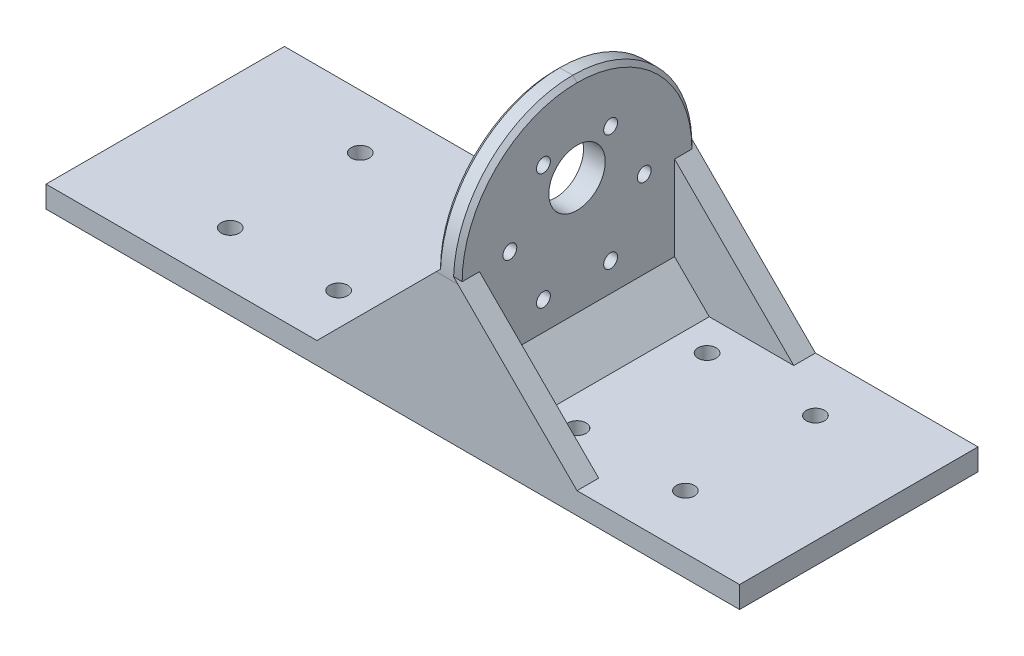
from build123d import *

# Parameters (mm, degrees)
SKETCH_1_W          = 160
SKETCH_1_H          = 55
EXTRUDE_1_DEPTH     = 5
EXTRUDE_2_DEPTH     = 55
FILLET_1_R          = 27.5
CUT_EXTRUDE_1_REACH = 113.608
SKETCH_3_R          = 6.5
SKETCH_4_R          = 1.6
CUT_EXTRUDE_2_DEPTH = 10
CHAMFER_1_SIZE      = 8
CHAMFER_2_SIZE      = 8
EXTRUDE_5_DEPTH     = 5
CHAMFER_3_SIZE      = 1
SKETCH_7_R          = 2.1
CUT_EXTRUDE_3_DEPTH = 5


# Some blends are built 0.0001 mm under size
with BuildPart() as part:
    # 草图1 → 凸台-拉伸1 (new body)
    with BuildSketch(Plane(origin=(0, 0, 0), x_dir=(1, 0, 0), z_dir=(0, 1, 0))):
        Rectangle(SKETCH_1_W, SKETCH_1_H)
    extrude(amount=EXTRUDE_1_DEPTH)

    # 草图2 → 凸台-拉伸2 (add)
    with BuildSketch(Plane(origin=(0, 5, 0), x_dir=(1, 0, 0), z_dir=(0, 1, 0))):
        Polygon((10, 0), (10, 27.5), (15, 27.5), (15, -27.5), (10, -27.5), align=None)
    extrude(amount=EXTRUDE_2_DEPTH)

    # 圆角1
    fillet_1_edges = [part.edges().sort_by_distance(p)[0] for p in [
        (12.5, 60, -27.5),
        (12.5, 60, 27.5),
    ]]
    fillet(fillet_1_edges, radius=FILLET_1_R - 0.0001)  # a hair under: the kernel refuses the full size

    # 草图3 → 切除-拉伸1 (cut, up to next)
    with BuildSketch(Plane.ZY.offset(-10), mode=Mode.PRIVATE) as cut_extrude_1_sk1:
        with Locations((0, 40)):
            Circle(SKETCH_3_R)
    cut_extrude_1_tool1 = extrude(cut_extrude_1_sk1.sketch, amount=-CUT_EXTRUDE_1_REACH, mode=Mode.PRIVATE) & part.part
    add(cut_extrude_1_tool1.solids().sort_by_distance((10, 40, 0))[0], mode=Mode.SUBTRACT)

    # 草图4 → 切除-拉伸2 (cut)
    with BuildSketch(Plane.ZY.offset(-10)):
        with Locations((15.5, 33)):
            Circle(SKETCH_4_R)
        with Locations((7.75, 19.576606241)):
            Circle(SKETCH_4_R)
        with Locations((-7.75, 19.576606241)):
            Circle(SKETCH_4_R)
        with Locations((-15.5, 33)):
            Circle(SKETCH_4_R)
        with Locations((-7.75, 46.423393759)):
            Circle(SKETCH_4_R)
        with Locations((7.75, 46.423393759)):
            Circle(SKETCH_4_R)
    extrude(amount=-CUT_EXTRUDE_2_DEPTH, mode=Mode.SUBTRACT)

    # 倒角1
    chamfer_1_edges = [part.edges().sort_by_distance(p)[0] for p in [
        (10, 5, 0),
    ]]
    chamfer(chamfer_1_edges, length=CHAMFER_1_SIZE)

    # 倒角2
    chamfer_2_edges = [part.edges().sort_by_distance(p)[0] for p in [
        (15, 5, 0),
    ]]
    chamfer(chamfer_2_edges, length=CHAMFER_2_SIZE)

    # 草图6 → 凸台-拉伸5 (add)
    with BuildSketch(Plane.XY.offset(27.5)):
        Polygon((10, 5), (10, 32.5), (-17.5, 5), align=None)
        Polygon((15, 32.5), (15, 5), (42.5, 5), align=None)
    extrude_5 = extrude(amount=-EXTRUDE_5_DEPTH)

    # 镜向1: 凸台-拉伸5 across plane
    add(extrude_5.mirror(Plane.XY))

    # 倒角3
    # the kernel refuses this chamfer: 1 mm, written as the material it takes off along each edge
    with BuildSketch(Plane(origin=(10, 32.5001, 0.0001), x_dir=(0, -0.09341724291060717, 0.9956270480089322), z_dir=(0, -0.9956270480089322, -0.09341724291060717))) as chamfer_3_piece_1_section:
        Polygon((27.4999 - CHAMFER_3_SIZE, 0), (27.4999, -CHAMFER_3_SIZE), (27.4999, 0), align=None)
    chamfer_3_piece_1 = revolve(axis=Axis((10, 32.5001, 0.0001), (-1, 0, 0)), revolution_arc=100.720458749, mode=Mode.PRIVATE)
    chamfer_3_piece_1 = split(chamfer_3_piece_1, bisect_by=Plane(origin=(20.22926311, 42.72926311, 18.191765192), z_dir=(-0.7071067811865475, 0.7071067811865477, 0)), keep=Keep.TOP, mode=Mode.PRIVATE)
    add(chamfer_3_piece_1, mode=Mode.SUBTRACT)
    with BuildSketch(Plane(origin=(10, 32.5001, -0.0001), x_dir=(0, -0.09341724291060717, -0.9956270480089322), z_dir=(0, -0.9956270480089322, 0.09341724291060717))) as chamfer_3_piece_2_section:
        Polygon((27.4999, CHAMFER_3_SIZE), (27.4999 - CHAMFER_3_SIZE, 0), (27.4999, 0), align=None)
    chamfer_3_piece_2 = revolve(axis=Axis((10, 32.5001, -0.0001), (1, 0, 0)), revolution_arc=100.720458749, mode=Mode.PRIVATE)
    chamfer_3_piece_2 = split(chamfer_3_piece_2, bisect_by=Plane(origin=(20.397792602, 42.897792602, -19.088683077), z_dir=(-0.7071067811865475, 0.7071067811865477, 0)), keep=Keep.TOP, mode=Mode.PRIVATE)
    add(chamfer_3_piece_2, mode=Mode.SUBTRACT)
    with BuildSketch(Plane(origin=(15, 32.5001, 0.0001), x_dir=(0, -0.09341724291060717, 0.9956270480089322), z_dir=(0, -0.9956270480089322, -0.09341724291060717))) as chamfer_3_piece_3_section:
        Polygon((27.4999 - CHAMFER_3_SIZE, 0), (27.4999, CHAMFER_3_SIZE), (27.4999, 0), align=None)
    chamfer_3_piece_3 = revolve(axis=Axis((15, 32.5001, 0.0001), (-1, 0, 0)), revolution_arc=100.720458749, mode=Mode.PRIVATE)
    chamfer_3_piece_3 = split(chamfer_3_piece_3, bisect_by=Plane(origin=(4.77073689, 42.72926311, 18.191765192), z_dir=(0.7071067811865476, 0.7071067811865476, 0)), keep=Keep.TOP, mode=Mode.PRIVATE)
    add(chamfer_3_piece_3, mode=Mode.SUBTRACT)
    with BuildSketch(Plane(origin=(15, 32.5001, -0.0001), x_dir=(0, -0.09341724291060717, -0.9956270480089322), z_dir=(0, -0.9956270480089322, 0.09341724291060717))) as chamfer_3_piece_4_section:
        Polygon((27.4999 - CHAMFER_3_SIZE, 0), (27.4999, -CHAMFER_3_SIZE), (27.4999, 0), align=None)
    chamfer_3_piece_4 = revolve(axis=Axis((15, 32.5001, -0.0001), (1, 0, 0)), revolution_arc=100.720458749, mode=Mode.PRIVATE)
    chamfer_3_piece_4 = split(chamfer_3_piece_4, bisect_by=Plane(origin=(4.77073689, 42.72926311, -18.191765192), z_dir=(0.7071067811865476, 0.7071067811865476, 0)), keep=Keep.TOP, mode=Mode.PRIVATE)
    add(chamfer_3_piece_4, mode=Mode.SUBTRACT)

    # 草图7 → 切除-拉伸3 (cut)
    with BuildSketch(Plane(origin=(0, 0, 0), x_dir=(-1, 0, 0), z_dir=(0, -1, 0))):
        with Locations(Location((50, -15, 0), (0, 0, 90))):
            Circle(SKETCH_7_R)
        with Locations(Location((25, -15, 0), (0, 0, 90))):
            Circle(SKETCH_7_R)
        with Locations(Location((-30, -15, 0), (0, 0, 90))):
            Circle(SKETCH_7_R)
        with Locations(Location((-55, -15, 0), (0, 0, 90))):
            Circle(SKETCH_7_R)
        with Locations(Location((-55, 15, 0), (0, 0, 270))):
            Circle(SKETCH_7_R)
        with Locations(Location((-30, 15, 0), (0, 0, 270))):
            Circle(SKETCH_7_R)
        with Locations(Location((25, 15, 0), (0, 0, 270))):
            Circle(SKETCH_7_R)
        with Locations(Location((50, 15, 0), (0, 0, 270))):
            Circle(SKETCH_7_R)
    extrude(amount=-CUT_EXTRUDE_3_DEPTH, mode=Mode.SUBTRACT)


solid = part.part
